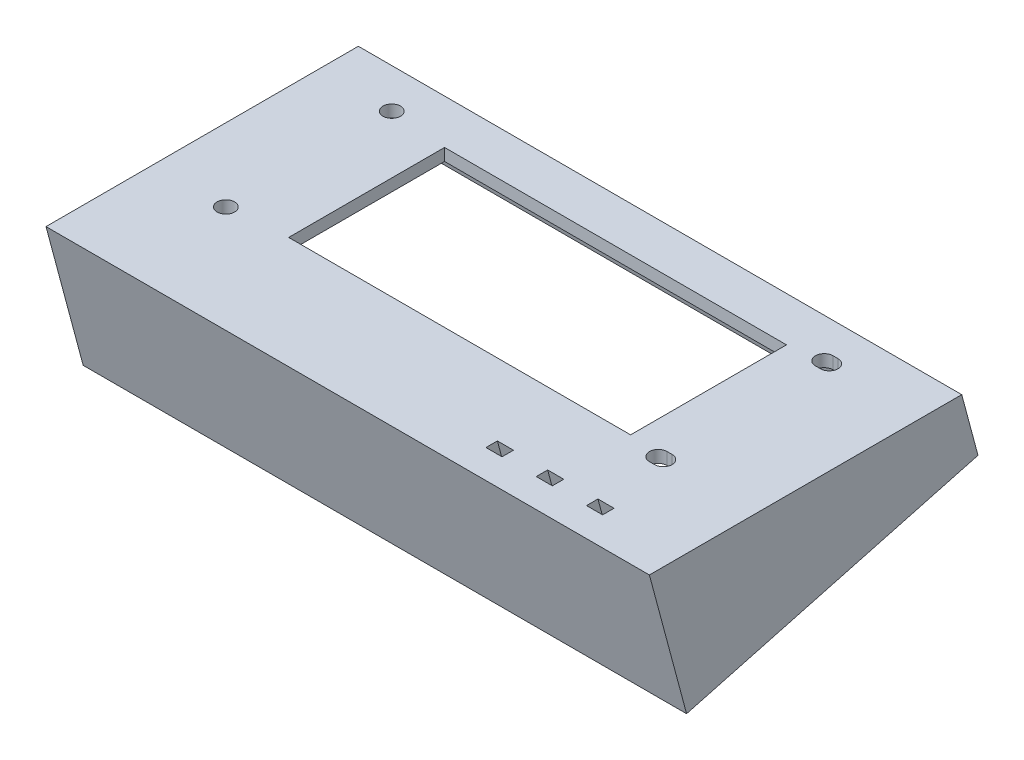
from build123d import *

# Parameters (mm, degrees)
SKETCH_1_W               = 120
SKETCH_1_H               = 50
EXTRUDE_2_DEPTH          = 2.5
SKETCH_1_3_R             = 1.75
SKETCH_1_3_W             = 68
SKETCH_1_3_H             = 31
CUT_EXTRUDE_1_DEPTH      = 66.296266207
EXTRUDE_START            = -60
EXTRUDE_3_DEPTH          = 120
EXTRUDE_3_2_DEPTH        = 2.5
EXTRUDE_START_2          = 57.5
EXTRUDE_3_3_DEPTH        = 2.5
CUT_EXTRUDE_2_DEPTH      = 129.109700543
CUT_EXTRUDE_2_DEPTH_BACK = 129.109700543
EXTRUDE_4_DEPTH          = 120
EXTRUDE_5_REACH          = 77.063
EXTRUDE_6_REACH          = 77.063
SKETCH_7_R               = 2.5
CUT_EXTRUDE_3_DEPTH      = 5
SKETCH_8_R               = 1.75
CUT_EXTRUDE_4_DEPTH      = 5
EXTRUDE_8_DEPTH          = 120
SKETCH_10_W              = 3.2
SKETCH_10_H              = 2.2
CUT_EXTRUDE_5_DEPTH      = 10


# Read off the part's stored shape, not the designer's step: 凸台-拉伸3
with BuildPart() as part:
    # 草图1 → 凸台-拉伸2 (new, along a direction that is not the sketch's normal)
    with BuildSketch(Plane(origin=(0, 0, 0), x_dir=(1, 0, 0), z_dir=(0, 1, 0))):
        Rectangle(SKETCH_1_W, SKETCH_1_H)
    extrude(amount=EXTRUDE_2_DEPTH, dir=(0, 0.9659258262890672, 0.2588190451025249))

    # 草图1<3> → 切除-拉伸1 (cut, through all)
    with BuildSketch(Plane(origin=(0, 0, 0), x_dir=(1, 0, 0), z_dir=(0, 1, 0))):
        with Locations(Location((-45.5, 16.5, 0), (0, 0, 270))):
            Circle(SKETCH_1_3_R)
        with Locations(Location((-45.5, -16.5, 0), (0, 0, 270))):
            Circle(SKETCH_1_3_R)
        Rectangle(SKETCH_1_3_W, SKETCH_1_3_H)
        with BuildLine():
            Line((41.5, 18.25), (40.5, 18.25))
            ThreePointArc((40.5, 18.25), (38.75, 16.5), (40.5, 14.75))
            Line((40.5, 14.75), (41.5, 14.75))
            ThreePointArc((41.5, 14.75), (43.25, 16.5), (41.5, 18.25))
        make_face()
        with BuildLine():
            Line((41.5, -18.25), (40.5, -18.25))
            ThreePointArc((40.5, -18.25), (38.75, -16.5), (40.5, -14.75))
            Line((40.5, -14.75), (41.5, -14.75))
            ThreePointArc((41.5, -14.75), (43.25, -16.5), (41.5, -18.25))
        make_face()
    extrude(amount=CUT_EXTRUDE_1_DEPTH, mode=Mode.SUBTRACT)

    # 凸台-拉伸3 outline → 凸台-拉伸3 (add)
    with BuildSketch(Plane.YZ.offset(EXTRUDE_START)):
        Polygon((-10.306305876, -25.173375885), (-9.659258263, -27.588190451), (0, -25), (0, -22.411809549), align=None)
        Polygon((-25.188400969, 30.367359126), (-24.541353356, 27.952544561), (0, 34.528380374), (0, 37.116570825), align=None)
    extrude(amount=EXTRUDE_3_DEPTH)

    # Extrude 3 2 outline → Extrude 3 2 (add)
    with BuildSketch(Plane.YZ.offset(EXTRUDE_START)):
        Polygon((-24.541353356, 27.952544561), (-10.306305876, -25.173375885), (0, -22.411809549), (0, 34.528380374), align=None)
    extrude(amount=EXTRUDE_3_2_DEPTH)

    # Extrude 3 3 outline → Extrude 3 3 (add)
    with BuildSketch(Plane.YZ.offset(EXTRUDE_START_2)):
        Polygon((-24.541353356, 27.952544561), (-10.306305876, -25.173375885), (0, -22.411809549), (0, 34.528380374), align=None)
    extrude(amount=EXTRUDE_3_3_DEPTH)

    # 草图4 → 切除-拉伸2 (cut, two sides: drawn at the far end of the back side and taken through both)
    with BuildSketch(Plane.ZY.offset(60).offset(-CUT_EXTRUDE_2_DEPTH_BACK)):
        Polygon((25.647047613, 2.414814566), (36.951962095, -0.61432814), (37.116570825, 0), align=None)
    extrude(amount=CUT_EXTRUDE_2_DEPTH + CUT_EXTRUDE_2_DEPTH_BACK, mode=Mode.SUBTRACT)

    # 草图5 → 凸台-拉伸4 (add)
    with BuildSketch(Plane.ZY.offset(60)):
        Polygon((25.647047613, 2.414814566), (36.951962095, -0.61432814), (36.304914483, -3.029142706), (25, 0), align=None)
    extrude(amount=-EXTRUDE_4_DEPTH)

    # 凸台-拉伸5: up to this plane
    extrude_5_end = Plane(origin=(0, 0, 0), z_dir=(0, 1, 0))
    # 草图6 → 凸台-拉伸5 (add, up to the surface)
    with BuildSketch(Plane(origin=(0, -15.909258263, -4.262872904), x_dir=(1, 0, 0), z_dir=(0, -0.9659258262890672, -0.25881904510252496)), mode=Mode.PRIVATE) as extrude_5_sk1:
        with BuildLine():
            Line((-60, -24.148145657), (-52, -24.148145657))
            Line((-52, -24.148145657), (-52, -20.148145657))
            ThreePointArc((-52, -20.148145657), (-53.171572875, -17.319718532), (-56, -16.148145657))
            Line((-56, -16.148145657), (-60, -16.148145657))
            Line((-60, -16.148145657), (-60, -24.148145657))
        make_face()
    extrude_5_tool1 = split(extrude(extrude_5_sk1.sketch, amount=-EXTRUDE_5_REACH, mode=Mode.PRIVATE), bisect_by=extrude_5_end, keep=Keep.BOTH, mode=Mode.PRIVATE)
    add(extrude_5_tool1.solids().sort_by_distance((-56.176115, -10.648952, -23.894601))[0])
    # 草图6 → 凸台-拉伸5 (add, up to the surface)
    with BuildSketch(Plane(origin=(0, -15.909258263, -4.262872904), x_dir=(1, 0, 0), z_dir=(0, -0.9659258262890672, -0.25881904510252496)), mode=Mode.PRIVATE) as extrude_5_sk2:
        with BuildLine():
            Line((60, -24.148145657), (52, -24.148145657))
            Line((52, -24.148145657), (52, -20.148145657))
            ThreePointArc((52, -20.148145657), (53.171572875, -17.319718532), (56, -16.148145657))
            Line((56, -16.148145657), (60, -16.148145657))
            Line((60, -16.148145657), (60, -24.148145657))
        make_face()
    extrude_5_tool2 = split(extrude(extrude_5_sk2.sketch, amount=-EXTRUDE_5_REACH, mode=Mode.PRIVATE), bisect_by=extrude_5_end, keep=Keep.BOTH, mode=Mode.PRIVATE)
    add(extrude_5_tool2.solids().sort_by_distance((56.176115, -10.648952, -23.894601))[0])

    # 草图6<4> → 凸台-拉伸6 (add, up to next)
    with BuildSketch(Plane(origin=(0, -15.909258263, -4.262872904), x_dir=(1, 0, 0), z_dir=(0, -0.9659258262890672, -0.25881904510252496)), mode=Mode.PRIVATE) as extrude_6_sk1:
        with BuildLine():
            Line((-60, 35.851854343), (-52, 35.851854343))
            Line((-52, 35.851854343), (-52, 31.851854343))
            ThreePointArc((-52, 31.851854343), (-53.171572875, 29.023427218), (-56, 27.851854343))
            Line((-56, 27.851854343), (-60, 27.851854343))
            Line((-60, 27.851854343), (-60, 35.851854343))
        make_face()
    extrude_6_tool1 = extrude(extrude_6_sk1.sketch, amount=-EXTRUDE_6_REACH, mode=Mode.PRIVATE) - part.part
    # 草图6<4> → 凸台-拉伸6 (add, up to next)
    with BuildSketch(Plane(origin=(0, -15.909258263, -4.262872904), x_dir=(1, 0, 0), z_dir=(0, -0.9659258262890672, -0.25881904510252496)), mode=Mode.PRIVATE) as extrude_6_sk2:
        with BuildLine():
            Line((60, 35.851854343), (52, 35.851854343))
            Line((52, 35.851854343), (52, 31.851854343))
            ThreePointArc((52, 31.851854343), (53.171572875, 29.023427218), (56, 27.851854343))
            Line((56, 27.851854343), (60, 27.851854343))
            Line((60, 27.851854343), (60, 35.851854343))
        make_face()
    extrude_6_tool2 = extrude(extrude_6_sk2.sketch, amount=-EXTRUDE_6_REACH, mode=Mode.PRIVATE) - part.part
    add(extrude_6_tool1.solids().sort_by_distance((-56.176115, -24.198707, 26.67377))[0])
    add(extrude_6_tool2.solids().sort_by_distance((56.176115, -24.198707, 26.67377))[0])

    # 草图7 → 切除-拉伸3 (cut)
    with BuildSketch(Plane(origin=(0, -15.909258263, -4.262872904), x_dir=(1, 0, 0), z_dir=(0, -0.9659258262890672, -0.25881904510252496))):
        with Locations(Location((-56, 31.851854343, 0), (0, 0, 270))):
            Circle(SKETCH_7_R)
        with Locations(Location((-56, -20.148145657, 0), (0, 0, 270))):
            Circle(SKETCH_7_R)
        with Locations(Location((56, -20.148145657, 0), (0, 0, 270))):
            Circle(SKETCH_7_R)
        with Locations(Location((56, 31.851854343, 0), (0, 0, 270))):
            Circle(SKETCH_7_R)
    extrude(amount=-CUT_EXTRUDE_3_DEPTH, mode=Mode.SUBTRACT)

    # 草图8 → 切除-拉伸4 (cut)
    with BuildSketch(Plane(origin=(0, -11.079629131, -2.968777678), x_dir=(1, 0, 0), z_dir=(0, -0.9659258262890672, -0.25881904510252496))):
        with Locations(Location((-56, 31.851854343, 0), (0, 0, 270))):
            Circle(SKETCH_8_R)
        with Locations(Location((-56, -20.148145657, 0), (0, 0, 270))):
            Circle(SKETCH_8_R)
        with Locations(Location((56, -20.148145657, 0), (0, 0, 270))):
            Circle(SKETCH_8_R)
        with Locations(Location((56, 31.851854343, 0), (0, 0, 270))):
            Circle(SKETCH_8_R)
    extrude(amount=-CUT_EXTRUDE_4_DEPTH, mode=Mode.SUBTRACT)

    # 草图11 → 凸台-拉伸8 (add)
    with BuildSketch(Plane.ZY.offset(60)):
        Polygon((25.647047613, 2.414814566), (37.763618437, 2.414814566), (36.951962095, -0.61432814), align=None)
    extrude(amount=-EXTRUDE_8_DEPTH)

    # 草图10 → 切除-拉伸5 (cut)
    with BuildSketch(Plane(origin=(0, 6.25, 1.674682453), x_dir=(1, 0, 0), z_dir=(0, -0.9659258262890672, -0.25881904510252524))):
        with Locations((33.4, 29.251854343)):
            Rectangle(SKETCH_10_W, SKETCH_10_H)
        with Locations((43.4, 29.251854343)):
            Rectangle(SKETCH_10_W, SKETCH_10_H)
        with Locations((23.4, 29.251854343)):
            Rectangle(SKETCH_10_W, SKETCH_10_H)
    extrude(amount=-CUT_EXTRUDE_5_DEPTH, mode=Mode.SUBTRACT)


solid = part.part
